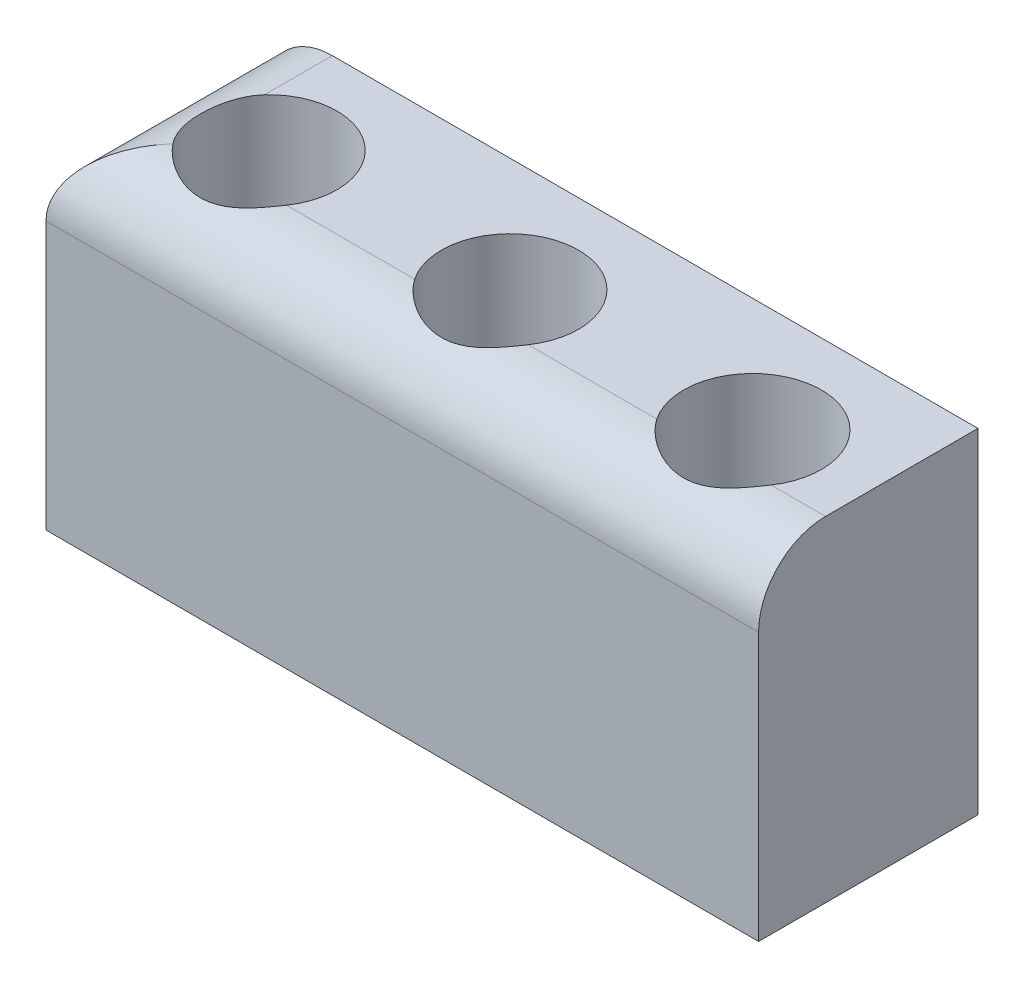
from build123d import *

# Parameters (mm, degrees)
SKETCH1_W           = 21.293186277
SKETCH1_H           = 6.556248908
SKETCH1_R           = 2.06
SKETCH1_R_2         = 2.04
SKETCH1_R_3         = 2.05
BOSS_EXTRUDE1_DEPTH = 10
FILLET1_R           = 2


with BuildPart() as part:
    # Sketch1 → Boss-Extrude1 (new body)
    with BuildSketch(Plane(origin=(0, 0, 0), x_dir=(1, 0, 0), z_dir=(0, 1, 0))):
        with Locations((10.646593139, 3.278124454)):
            Rectangle(SKETCH1_W, SKETCH1_H)
        with Locations(Location((17.959518774, 3.152151811, 0), (0, 0, 270))):
            Circle(SKETCH1_R, mode=Mode.SUBTRACT)
        with Locations(Location((3.502477391, 3.152151811, 0), (0, 0, 270))):
            Circle(SKETCH1_R_2, mode=Mode.SUBTRACT)
        with Locations(Location((10.712545691, 3.152151811, 0), (0, 0, 270))):
            Circle(SKETCH1_R_3, mode=Mode.SUBTRACT)
    extrude(amount=BOSS_EXTRUDE1_DEPTH)

    # Fillet1
    # the kernel refuses this fillet: 2 mm, written as the material it takes off along each edge
    with BuildSketch(Plane(origin=(-5, 10, 0), x_dir=(0, -1, 0), z_dir=(1, 0, 0))) as fillet1_piece_1:
        with BuildLine():
            CenterArc((FILLET1_R, FILLET1_R), FILLET1_R, 180, 90)
            Line((0, FILLET1_R), (0, 0))
            Line((0, 0), (FILLET1_R, 0))
        make_face()
    extrude(amount=31.293186277, mode=Mode.SUBTRACT)
    with BuildSketch(Plane(origin=(0, 10, -11.556248908), x_dir=(0, -1, 0), z_dir=(0, 0, 1))) as fillet1_piece_2:
        with BuildLine():
            CenterArc((FILLET1_R, FILLET1_R), FILLET1_R, 180, 90)
            Line((0, FILLET1_R), (0, 0))
            Line((0, 0), (FILLET1_R, 0))
        make_face()
    extrude(amount=16.556248908, mode=Mode.SUBTRACT)


solid = part.part
